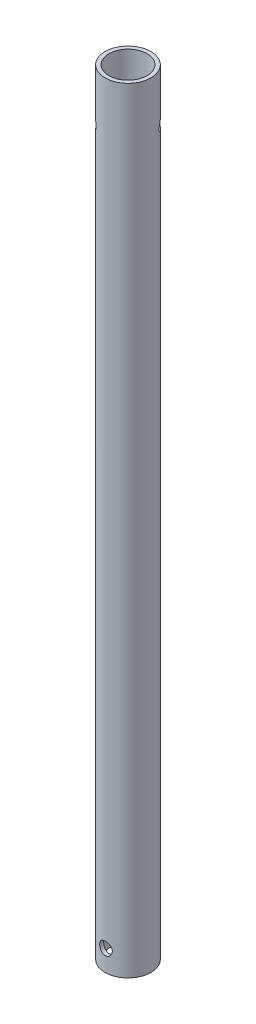
from build123d import *

# Parameters (mm, degrees)
SKETCH1_R               = 6
SKETCH1_R_2             = 5
BOSS_EXTRUDE1_DEPTH     = 203.2
CUT_EXTRUDE1_DEPTH      = 204.377088188
CUT_EXTRUDE1_DEPTH_BACK = 204.377088188
SKETCH2_R               = 1.65
CUT_EXTRUDE2_DEPTH      = 204.472727085
CUT_EXTRUDE2_DEPTH_BACK = 204.472727085


with BuildPart() as part:
    # Sketch1 → Boss-Extrude1 (new body)
    with BuildSketch(Plane(origin=(0, 0, 0), x_dir=(1, 0, 0), z_dir=(0, 1, 0))):
        Circle(SKETCH1_R)
        Circle(SKETCH1_R_2, mode=Mode.SUBTRACT)
    extrude(amount=BOSS_EXTRUDE1_DEPTH)

    # Sketch2 → Cut-Extrude1 (cut, two sides: drawn at the far end of the back side and taken through both)
    with BuildSketch(Plane.XY.offset(-CUT_EXTRUDE1_DEPTH_BACK)):
        with Locations((0, 5.5)):
            Circle(SKETCH2_R)
    extrude(amount=CUT_EXTRUDE1_DEPTH + CUT_EXTRUDE1_DEPTH_BACK, mode=Mode.SUBTRACT)

    # Sketch5 → Cut-Extrude2 (cut, two sides: drawn at the far end of the back side and taken through both)
    with BuildSketch(Plane(origin=(-1.545353665, 0, 1.346989996), x_dir=(0.6570682906375933, 0, 0.7538310562974913), z_dir=(-0.7538310562974911, 0, 0.6570682906375932)).offset(-CUT_EXTRUDE2_DEPTH_BACK)):
        with BuildLine():
            ThreePointArc((0, 188.45), (1.25, 189.7), (0, 190.95))
            ThreePointArc((0, 190.95), (-1.25, 189.7), (0, 188.45))
        make_face()
    extrude(amount=CUT_EXTRUDE2_DEPTH + CUT_EXTRUDE2_DEPTH_BACK, mode=Mode.SUBTRACT)


solid = part.part
